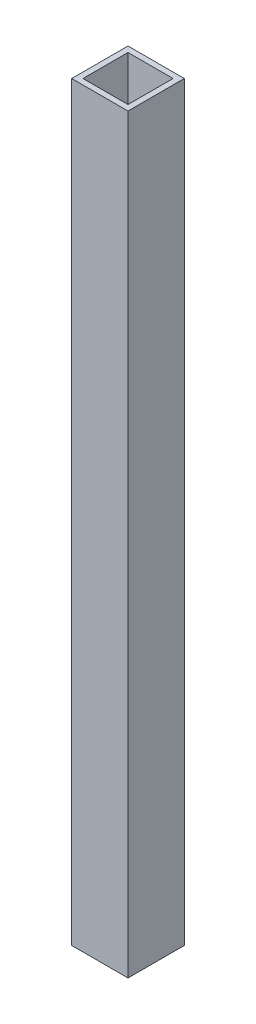
from build123d import *

# Parameters (mm, degrees)
SKETCH1_W           = 15
SKETCH1_H           = 15
SKETCH1_W_2         = 12
SKETCH1_H_2         = 12
EXTRUDE_THIN1_DEPTH = 200


with BuildPart() as part:
    # Sketch1 → Extrude-Thin1 (new body)
    with BuildSketch(Plane(origin=(0, 0, 0), x_dir=(1, 0, 0), z_dir=(0, 1, 0))):
        with Locations((7.5, 7.5)):
            Rectangle(SKETCH1_W, SKETCH1_H)
        with Locations((7.5, 7.5)):
            Rectangle(SKETCH1_W_2, SKETCH1_H_2, mode=Mode.SUBTRACT)
    extrude(amount=EXTRUDE_THIN1_DEPTH)


solid = part.part
